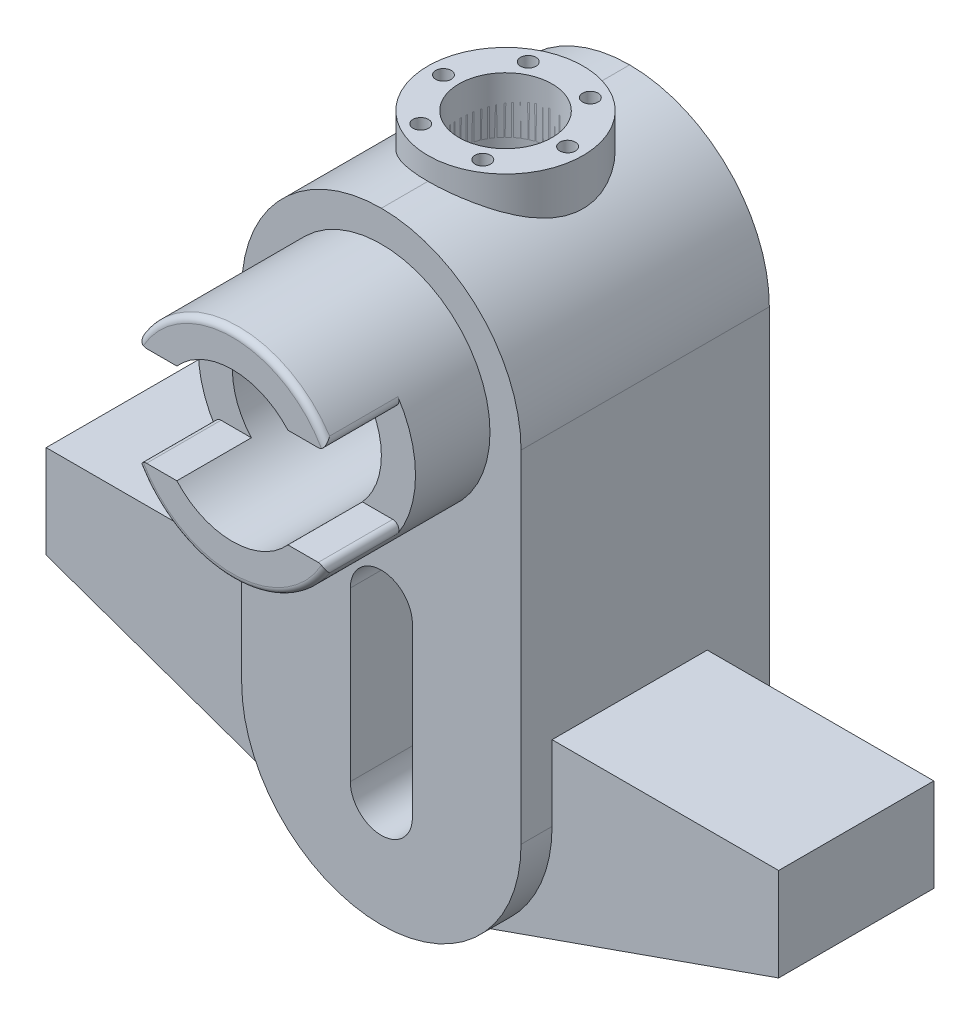
from build123d import *

# Parameters (mm, degrees)
SKETCH_1_W               = 45
SKETCH_1_H               = 100
EXTRUDE_1_DEPTH          = 40
FILLET_1_R               = 22.5
SKETCH_2_R               = 17.5
EXTRUDE_2_DEPTH          = 24
SKETCH_4_R               = 12
CUT_EXTRUDE_2_DEPTH      = 85.274847968
EXTRUDE_START            = 10
EXTRUDE_4_DEPTH          = 25
SKETCH_5_W               = 62.313378502
SKETCH_5_H               = 16
CUT_EXTRUDE_5_DEPTH      = 12
SKETCH_12_R              = 12.5
EXTRUDE_9_DEPTH          = 9
SKETCH_13_R              = 7.5
CUT_EXTRUDE_6_DEPTH      = 15
CUT_EXTRUDE_7_DEPTH      = 90.185529408
PATTERN_CIRCULAR_2_COUNT = 6
FILLET_2_R               = 1


with BuildPart() as part:
    # 스케치1 → 보스-돌출1 (new body)
    with BuildSketch(Plane.XY):
        Rectangle(SKETCH_1_W, SKETCH_1_H)
    extrude(amount=EXTRUDE_1_DEPTH)

    # 필렛1
    fillet_1_edges = [part.edges().sort_by_distance(p)[0] for p in [
        (22.5, -50, 20),
        (-22.5, -50, 20),
        (22.5, 50, 20),
        (-22.5, 50, 20),
    ]]
    fillet(fillet_1_edges, radius=FILLET_1_R - 0.0001)  # a hair under: the kernel refuses the full size

    # 스케치2 → 보스-돌출2 (add)
    with BuildSketch(Plane.XY.offset(40)):
        with Locations((0, 27.5)):
            Circle(SKETCH_2_R)
    extrude(amount=EXTRUDE_2_DEPTH)

    # 스케치4 → 컷-돌출2 (cut, through all)
    with BuildSketch(Plane(origin=(0, 0, 0), x_dir=(-1, 0, 0), z_dir=(0, 0, -1))):
        with Locations((0, 27.5)):
            Circle(SKETCH_4_R)
    extrude(amount=-CUT_EXTRUDE_2_DEPTH, mode=Mode.SUBTRACT)

    # 스케치7 → 보스-돌출4 (add)
    with BuildSketch(Plane.XY.offset(EXTRUDE_START)):
        with BuildLine():
            Line((-22.5, -15.399079786), (-59, -15.399079786))
            Line((-59, -15.399079786), (-59, -30.399079786))
            Line((-59, -30.399079786), (-10.046418281, -47.63254777))
            ThreePointArc((-10.046418281, -47.63254777), (-19.134973365, -39.336502623), (-22.5, -27.5))
            Line((-22.5, -27.5), (-22.5, -15.399079786))
        make_face()
    extrude_4 = extrude(amount=EXTRUDE_4_DEPTH)

    # 대칭 복사1: 보스-돌출4 across plane
    add(extrude_4.mirror(Plane.ZY))

    # 스케치5 → 컷-돌출5 (cut)
    with BuildSketch(Plane.XY.offset(64)):
        with Locations((0, 27.5)):
            Rectangle(SKETCH_5_W, SKETCH_5_H)
    extrude(amount=-CUT_EXTRUDE_5_DEPTH, mode=Mode.SUBTRACT)


with BuildPart() as body_2:
    # 스케치12 → 보스-돌출9 (new body)
    with BuildSketch(Plane(origin=(0, 44.600920214, 0), x_dir=(1, 0, 0), z_dir=(0, 1, 0))):
        with Locations(Location((0, -20, 0), (0, 0, 270))):
            Circle(SKETCH_12_R)
    extrude(amount=EXTRUDE_9_DEPTH)


with BuildPart() as cut_extrude_6_tool:
    # 스케치13 → 컷-돌출6 (new body)
    with BuildSketch(Plane(origin=(0, 53.600920214, 0), x_dir=(1, 0, 0), z_dir=(0, 1, 0))):
        with Locations(Location((0, -20, 0), (0, 0, 270))):
            Circle(SKETCH_13_R)
    extrude(amount=-CUT_EXTRUDE_6_DEPTH)


with BuildPart() as part_1:
    add(part.part)

    # 컷-돌출6: cut by cut_extrude_6_tool
    add(cut_extrude_6_tool.part, mode=Mode.SUBTRACT)

    # 스케치18 → 컷-돌출7 (cut, through all)
    with BuildSketch(Plane.XY.offset(40)):
        with BuildLine():
            Line((5, -5.489754336), (5, -32.5))
            ThreePointArc((5, -32.5), (0, -37.5), (-5, -32.5))
            Line((-5, -32.5), (-5, -5.489754336))
            ThreePointArc((-5, -5.489754336), (0, -0.489754336), (5, -5.489754336))
        make_face()
    extrude(amount=-CUT_EXTRUDE_7_DEPTH, mode=Mode.SUBTRACT)


with BuildPart() as body_2_1:
    add(body_2.part)

    # 컷-돌출6: cut by cut_extrude_6_tool
    add(cut_extrude_6_tool.part, mode=Mode.SUBTRACT)

    # 스케치21 → M3 나사 구멍2 (revolve, cut)
    with BuildSketch(Plane(origin=(-10, 54.600920214, 20), x_dir=(0, 0, 1), z_dir=(1, 0, 0))):
        Polygon((0, 0), (0, 6.751075774), (1.25, 6), (1.25, 0.265564413), (1.525, 0), align=None)
    hole_wizard_m3_2 = revolve(axis=Axis((-10, 60.950920214, 20), (0, -1, 0)), mode=Mode.SUBTRACT)


with BuildPart() as pattern_circular_2_tool:
    # 원형 패턴2: M3 나사 구멍2 ×6 about axis
    pattern_circular_2_axis = Axis((0, 0, 20), (0, 1, 0))
    for i in range(1, PATTERN_CIRCULAR_2_COUNT):
        add(hole_wizard_m3_2.rotate(pattern_circular_2_axis, i * 360 / PATTERN_CIRCULAR_2_COUNT))


with BuildPart() as part_2:
    add(part_1.part)

    # 원형 패턴2: cut by pattern_circular_2_tool
    add(pattern_circular_2_tool.part, mode=Mode.SUBTRACT)

    # 필렛2
    fillet_2_edges = [part_2.edges().sort_by_distance(p)[0] for p in [
        (0, 45, 64),
        (0, 10, 64),
        (-15.564382416, 35.5, 58),
        (15.564382416, 35.5, 58),
        (-15.564382416, 19.5, 58),
        (15.564382416, 19.5, 58),
    ]]
    fillet(fillet_2_edges, radius=FILLET_2_R)


with BuildPart() as body_2_2:
    add(body_2_1.part)

    # 원형 패턴2: cut by pattern_circular_2_tool
    add(pattern_circular_2_tool.part, mode=Mode.SUBTRACT)


solid = Compound([part_2.part, body_2_2.part])
